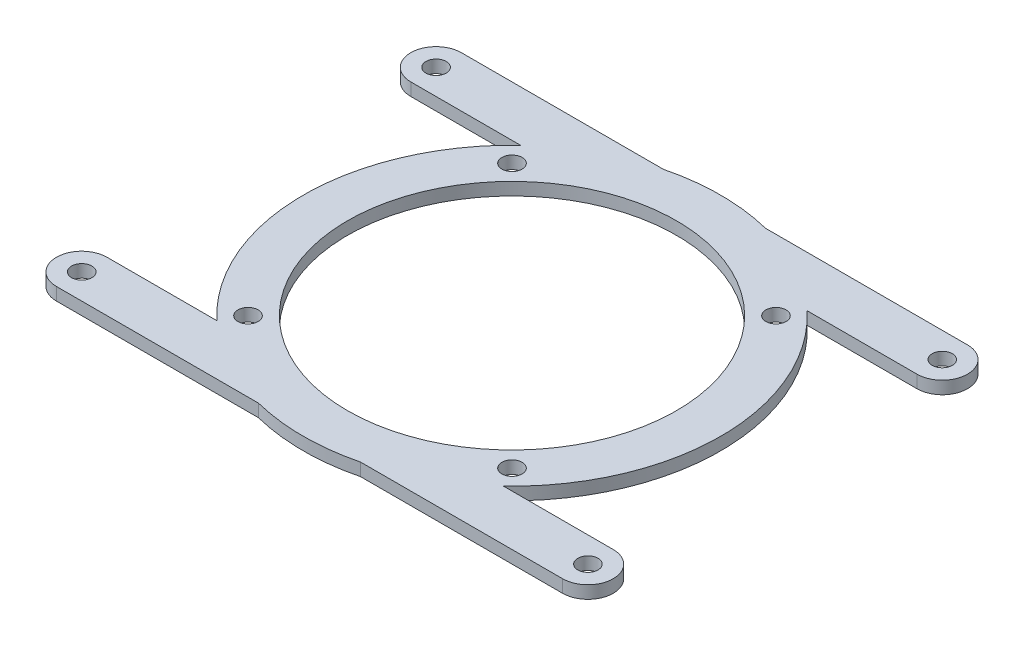
from build123d import *
from build123d.topology import SkipClean

# Parameters (mm, degrees)
SKETCH1_R           = 1.6
BOSS_EXTRUDE1_DEPTH = 2
SKETCH2_R           = 48
SKETCH2_R_2         = 42
SKETCH2_R_3         = 1.6
BOSS_EXTRUDE2_DEPTH = 2
SKETCH3_R           = 1.6
BOSS_EXTRUDE3_DEPTH = 2
CUT_EXTRUDE1_DEPTH  = 10
FILLET1_R           = 3
BOSS_EXTRUDE4_DEPTH = 2
CUT_EXTRUDE2_START  = -10
SKETCH6_R           = 26
CUT_EXTRUDE2_DEPTH  = 10
CUT_EXTRUDE3_START  = -10
SKETCH7_R           = 112.740823419
SKETCH7_R_2         = 33
CUT_EXTRUDE3_DEPTH  = 10
BOSS_EXTRUDE5_START = -2
SKETCH8_R           = 1.6
SKETCH8_R_2         = 26
BOSS_EXTRUDE5_DEPTH = 2
SKETCH9_R           = 1.6
CUT_EXTRUDE4_DEPTH  = 5


with BuildPart() as part:
    # Sketch1 → Boss-Extrude1 (new body)
    with BuildSketch(Plane(origin=(0, 0, 0), x_dir=(1, 0, 0), z_dir=(0, 1, 0))):
        with BuildLine():
            Line((-51.943772875, 37.828427125), (-29.299283734, 15.183937983))
            ThreePointArc((-29.299283734, 15.183937983), (0, 33), (29.299283734, 15.183937983))
            Line((29.299283734, 15.183937983), (51.943772875, 37.828427125))
            ThreePointArc((51.943772875, 37.828427125), (57.600627125, 37.828427125), (57.600627125, 32.171572875))
            Line((57.600627125, 32.171572875), (32.280845123, 6.851790873))
            ThreePointArc((32.280845123, 6.851790873), (33, 0), (32.280845123, -6.851790873))
            Line((32.280845123, -6.851790873), (57.600627125, -32.171572875))
            ThreePointArc((57.600627125, -32.171572875), (57.600627125, -37.828427125), (51.943772875, -37.828427125))
            Line((51.943772875, -37.828427125), (29.299283734, -15.183937983))
            ThreePointArc((29.299283734, -15.183937983), (0, -33), (-29.299283734, -15.183937983))
            Line((-29.299283734, -15.183937983), (-51.943772875, -37.828427125))
            ThreePointArc((-51.943772875, -37.828427125), (-57.600627125, -37.828427125), (-57.600627125, -32.171572875))
            Line((-57.600627125, -32.171572875), (-32.280845123, -6.851790873))
            ThreePointArc((-32.280845123, -6.851790873), (-33, 0), (-32.280845123, 6.851790873))
            Line((-32.280845123, 6.851790873), (-57.600627125, 32.171572875))
            ThreePointArc((-57.600627125, 32.171572875), (-57.600627125, 37.828427125), (-51.943772875, 37.828427125))
        make_face()
        with Locations(Location((54.7722, 35, 0), (0, 0, 270))):
            Circle(SKETCH1_R, mode=Mode.SUBTRACT)
        with Locations(Location((-54.7722, 35, 0), (0, 0, 90))):
            Circle(SKETCH1_R, mode=Mode.SUBTRACT)
        with Locations(Location((54.7722, -35, 0), (0, 0, 90))):
            Circle(SKETCH1_R, mode=Mode.SUBTRACT)
        with Locations(Location((-54.7722, -35, 0), (0, 0, 270))):
            Circle(SKETCH1_R, mode=Mode.SUBTRACT)
        with Locations(Location((20.859650045, 20.859650045, 0), (0, 0, 270))):
            Circle(SKETCH1_R, mode=Mode.SUBTRACT)
        with Locations(Location((-20.859650045, 20.859650045, 0), (0, 0, 90))):
            Circle(SKETCH1_R, mode=Mode.SUBTRACT)
        with Locations(Location((20.859650045, -20.859650045, 0), (0, 0, 90))):
            Circle(SKETCH1_R, mode=Mode.SUBTRACT)
        with Locations(Location((-20.859650045, -20.859650045, 0), (0, 0, 270))):
            Circle(SKETCH1_R, mode=Mode.SUBTRACT)
        with BuildLine():
            Line((0, 4.242640687), (-16.140662024, 20.383302711))
            ThreePointArc((-16.140662024, 20.383302711), (0, 26), (16.140662024, 20.383302711))
            Line((16.140662024, 20.383302711), (0, 4.242640687))
        make_face(mode=Mode.SUBTRACT)
        with BuildLine():
            Line((0, -4.242640687), (-16.140662024, -20.383302711))
            ThreePointArc((-16.140662024, -20.383302711), (0, -26), (16.140662024, -20.383302711))
            Line((16.140662024, -20.383302711), (0, -4.242640687))
        make_face(mode=Mode.SUBTRACT)
        with BuildLine():
            Line((4.242640687, 0), (20.383302711, -16.140662024))
            ThreePointArc((20.383302711, -16.140662024), (26, 0), (20.383302711, 16.140662024))
            Line((20.383302711, 16.140662024), (4.242640687, 0))
        make_face(mode=Mode.SUBTRACT)
        with BuildLine():
            Line((-4.242640687, 0), (-20.383302711, -16.140662024))
            ThreePointArc((-20.383302711, -16.140662024), (-26, 0), (-20.383302711, 16.140662024))
            Line((-20.383302711, 16.140662024), (-4.242640687, 0))
        make_face(mode=Mode.SUBTRACT)
    extrude(amount=BOSS_EXTRUDE1_DEPTH)

    # Sketch2 → Boss-Extrude2 (add)
    with BuildSketch(Plane(origin=(0, 2, 0), x_dir=(1, 0, 0), z_dir=(0, 1, 0))):
        Circle(SKETCH2_R)
        Circle(SKETCH2_R_2, mode=Mode.SUBTRACT)
        with Locations(Location((31.819805153, 31.819805153, 0), (0, 0, 270))):
            Circle(SKETCH2_R_3, mode=Mode.SUBTRACT)
        with Locations(Location((-31.819805153, 31.819805153, 0), (0, 0, 270))):
            Circle(SKETCH2_R_3, mode=Mode.SUBTRACT)
        with Locations(Location((31.819805153, -31.819805153, 0), (0, 0, 270))):
            Circle(SKETCH2_R_3, mode=Mode.SUBTRACT)
        with Locations(Location((-31.819805153, -31.819805153, 0), (0, 0, 270))):
            Circle(SKETCH2_R_3, mode=Mode.SUBTRACT)
    extrude(amount=-BOSS_EXTRUDE2_DEPTH)

    # Sketch3 → Boss-Extrude3 (add)
    # profile 1 of 2: a face of its own
    with BuildSketch(Plane(origin=(0, 2, 0), x_dir=(1, 0, 0), z_dir=(0, 1, 0))):
        with BuildLine():
            Line((34.819811892, 31.819805153), (34.819811892, -31.819805153))
            ThreePointArc((34.819811892, -31.819805153), (31.819805153, -34.819811892), (28.819798415, -31.819805153))
            Line((28.819798415, -31.819805153), (28.819798415, 31.819805153))
            ThreePointArc((28.819798415, 31.819805153), (31.819805153, 34.819811892), (34.819811892, 31.819805153))
        make_face()
        with Locations(Location((31.819805153, -31.819805153, 0), (0, 0, 270))):
            Circle(SKETCH3_R, mode=Mode.SUBTRACT)
        with Locations(Location((31.819805153, 31.819805153, 0), (0, 0, 270))):
            Circle(SKETCH3_R, mode=Mode.SUBTRACT)
    # profile 2 of 2: a face of its own
    with BuildSketch(Plane(origin=(0, 2, 0), x_dir=(1, 0, 0), z_dir=(0, 1, 0))):
        with BuildLine():
            Line((-28.819798415, -31.819805153), (-28.819798415, 31.819805153))
            ThreePointArc((-28.819798415, 31.819805153), (-31.819805153, 34.819811892), (-34.819811892, 31.819805153))
            Line((-34.819811892, 31.819805153), (-34.819811892, -31.819805153))
            ThreePointArc((-34.819811892, -31.819805153), (-31.819805153, -34.819811892), (-28.819798415, -31.819805153))
        make_face()
        with Locations(Location((-31.819805153, 31.819805153, 0), (0, 0, 270))):
            Circle(SKETCH3_R, mode=Mode.SUBTRACT)
        with Locations(Location((-31.819805153, -31.819805153, 0), (0, 0, 270))):
            Circle(SKETCH3_R, mode=Mode.SUBTRACT)
    extrude(amount=-BOSS_EXTRUDE3_DEPTH)

    # Sketch4 → Cut-Extrude1 (cut)
    with BuildSketch(Plane(origin=(0, 2, 0), x_dir=(1, 0, 0), z_dir=(0, 1, 0))):
        Polygon((-28.819805153, 31.819805153), (-28.819805153, 24.740165209), (0, 38.846192425), (28.819805153, 24.740165209), (28.819805153, 31.819805153), (28.819805153, 53.488724091), (-28.819805153, 53.488724091), align=None)
        Polygon((28.819805153, -31.819805153), (28.819805153, -27.443703625), (0, -37.592318486), (-28.819805153, -27.443703625), (-28.819805153, -31.819805153), (-28.819805153, -57.678243433), (28.819805153, -57.678243433), align=None)
    extrude(amount=-CUT_EXTRUDE1_DEPTH, mode=Mode.SUBTRACT)

    # Fillet1
    # the kernel refuses this fillet: 3 mm, written as the material it takes off along each edge
    with BuildSketch(Plane(origin=(-28.819805153, -16.95161691, -38.385138152), x_dir=(0, 0, 1), z_dir=(0, 1, 0)), Plane(origin=(28.819805153, -16.95161691, 38.385138152), x_dir=(0, 0, -1), z_dir=(0, 1, 0))) as fillet1_piece_1:
        with BuildLine():
            CenterArc((6.565332998, -3), FILLET1_R, 90, 135)
            ThreePointArc((4.444012655, -5.121320344), (2.131461319, -2.639230371), (0, 0))
            Line((0, 0), (6.565332998, 0))
        make_face()
    extrude(amount=35.903233819, mode=Mode.SUBTRACT)
    with BuildSketch(Plane(origin=(-28.819805153, -16.95161691, 38.385138152), x_dir=(-0.755284934005079, 0, -0.6553965734308833), z_dir=(0, 1, 0)), Plane(origin=(28.819805153, -16.95161691, -38.385138152), x_dir=(0.7552849340050823, 0, 0.6553965734308795), z_dir=(0, 1, 0))) as fillet1_piece_2:
        with BuildLine():
            CenterArc((6.568751552, -2.99250738), FILLET1_R, 85.949727095, 135)
            Line((4.30289675, -4.9586971), (0, 0))
            ThreePointArc((0, 0), (3.390323382, 0.11988192), (6.780646764, 0))
        make_face()
    extrude(amount=35.903233819, mode=Mode.SUBTRACT)


with BuildPart() as boss_extrude4_tool:
    # Sketch5 → Boss-Extrude4 (new body)
    with BuildSketch(Plane(origin=(0, 2, 0), x_dir=(1, 0, 0), z_dir=(0, 1, 0))):
        Polygon((-31.819798415, 34.819811892), (31.819798415, 34.819811892), (29.753362448, 32.753375926), (28.819798415, 31.819811892), (28.819798415, 28.819811892), (0, 28.819811892), (-28.819798415, 28.819811892), (-28.819798415, 31.819811892), align=None)
        Polygon((-28.819798415, -31.819811892), (-31.819798415, -34.819811892), (31.819798415, -34.819811892), (29.753362448, -32.753375926), (28.819798415, -31.819811892), (28.819798415, -28.819811892), (0, -28.819811892), (-28.819798415, -28.819811892), align=None)
    extrude(amount=-BOSS_EXTRUDE4_DEPTH)


with BuildPart() as part_1:
    add(part.part)


with BuildPart() as part_2:
    # Boss-Extrude4: joined with boss_extrude4_tool
    add(part_1.part.fuse(boss_extrude4_tool.part, tol=0.00001))

    # Sketch6 → Cut-Extrude2 (cut)
    with BuildSketch(Plane(origin=(0, 2, 0), x_dir=(1, 0, 0), z_dir=(0, 1, 0)).offset(CUT_EXTRUDE2_START)):
        with Locations(Location((0, 0, 0), (0, 0, 270))):
            Circle(SKETCH6_R)
    extrude(amount=CUT_EXTRUDE2_DEPTH, mode=Mode.SUBTRACT)

    # Sketch7 → Cut-Extrude3 (cut)
    with SkipClean():  # the faces are left unmerged after this step: merging them gives an invalid solid
        with BuildSketch(Plane(origin=(0, 2, 0), x_dir=(1, 0, 0), z_dir=(0, 1, 0)).offset(CUT_EXTRUDE3_START)):
            Circle(SKETCH7_R)
            with Locations(Location((0, 0, 0), (0, 0, 270))):
                Circle(SKETCH7_R_2, mode=Mode.SUBTRACT)
        extrude(amount=CUT_EXTRUDE3_DEPTH, mode=Mode.SUBTRACT)

    # Sketch8 → Boss-Extrude5 (add)
    # profile 1 of 5: a face of its own
    with SkipClean():  # the faces are left unmerged after this step: merging them gives an invalid solid
        with BuildSketch(Plane(origin=(0, 2, 0), x_dir=(1, 0, 0), z_dir=(0, 1, 0)).offset(BOSS_EXTRUDE5_START)):
            with BuildLine():
                ThreePointArc((60, 24), (64, 28), (60, 32))
                Line((60, 32), (8.062257748, 32))
                ThreePointArc((8.062257748, 32), (15.86830384, 28.934355587), (22.649503306, 24))
                Line((22.649503306, 24), (60, 24))
            make_face()
            with Locations(Location((60, 28, 0), (0, 0, 270))):
                Circle(SKETCH8_R, mode=Mode.SUBTRACT)
        # profile 2 of 5: a face of its own
        with BuildSketch(Plane(origin=(0, 2, 0), x_dir=(1, 0, 0), z_dir=(0, 1, 0)).offset(BOSS_EXTRUDE5_START)):
            with BuildLine():
                ThreePointArc((-22.649503306, 24), (-15.86830384, 28.934355587), (-8.062257748, 32))
                Line((-8.062257748, 32), (-60, 32))
                ThreePointArc((-60, 32), (-64, 28), (-60, 24))
                Line((-60, 24), (-22.649503306, 24))
            make_face()
            with Locations(Location((-60, 28, 0), (0, 0, 270))):
                Circle(SKETCH8_R, mode=Mode.SUBTRACT)
        # profile 3 of 5: a face of its own
        with BuildSketch(Plane(origin=(0, 2, 0), x_dir=(1, 0, 0), z_dir=(0, 1, 0)).offset(BOSS_EXTRUDE5_START)):
            with BuildLine():
                ThreePointArc((-8.062257748, -32), (-15.86830384, -28.934355587), (-22.649503306, -24))
                Line((-22.649503306, -24), (-60, -24))
                ThreePointArc((-60, -24), (-64, -28), (-60, -32))
                Line((-60, -32), (-8.062257748, -32))
            make_face()
            with Locations(Location((-60, -28, 0), (0, 0, 270))):
                Circle(SKETCH8_R, mode=Mode.SUBTRACT)
        # profile 4 of 5: a face of its own
        with BuildSketch(Plane(origin=(0, 2, 0), x_dir=(1, 0, 0), z_dir=(0, 1, 0)).offset(BOSS_EXTRUDE5_START)):
            with BuildLine():
                Line((60, -24), (22.649503306, -24))
                ThreePointArc((22.649503306, -24), (15.86830384, -28.934355587), (8.062257748, -32))
                Line((8.062257748, -32), (60, -32))
                ThreePointArc((60, -32), (64, -28), (60, -24))
            make_face()
            with Locations(Location((60, -28, 0), (0, 0, 270))):
                Circle(SKETCH8_R, mode=Mode.SUBTRACT)
        # profile 5 of 5: a face of its own
        with BuildSketch(Plane(origin=(0, 2, 0), x_dir=(1, 0, 0), z_dir=(0, 1, 0)).offset(BOSS_EXTRUDE5_START)):
            with BuildLine():
                Line((22.649503306, 24), (0, 32))
                Line((0, 32), (-22.649503306, 24))
                ThreePointArc((-22.649503306, 24), (-33, 0), (-22.649503306, -24))
                Line((-22.649503306, -24), (0, -32))
                Line((0, -32), (22.649503306, -24))
                ThreePointArc((22.649503306, -24), (30.302092412, -13.068404472), (33, 0))
                ThreePointArc((33, 0), (30.302092412, 13.068404472), (22.649503306, 24))
            make_face()
            with Locations(Location((-20.859650045, -20.859650045, 0), (0, 0, 270))):
                Circle(SKETCH8_R, mode=Mode.SUBTRACT)
            with Locations(Location((20.859650045, -20.859650045, 0), (0, 0, 90))):
                Circle(SKETCH8_R, mode=Mode.SUBTRACT)
            with Locations(Location((-20.859650045, 20.859650045, 0), (0, 0, 90))):
                Circle(SKETCH8_R, mode=Mode.SUBTRACT)
            with Locations(Location((0, 0, 0), (0, 0, 270))):
                Circle(SKETCH8_R_2, mode=Mode.SUBTRACT)
            with Locations(Location((20.859650045, 20.859650045, 0), (0, 0, 270))):
                Circle(SKETCH8_R, mode=Mode.SUBTRACT)
        extrude(amount=BOSS_EXTRUDE5_DEPTH)

    # Sketch9 → Cut-Extrude4 (cut)
    with SkipClean():  # the faces are left unmerged after this step: merging them gives an invalid solid
        with BuildSketch(Plane(origin=(0, 2, 0), x_dir=(1, 0, 0), z_dir=(0, 1, 0))):
            with Locations(Location((40, 28, 0), (0, 0, 270))):
                Circle(SKETCH9_R)
            with Locations(Location((-40, 28, 0), (0, 0, 270))):
                Circle(SKETCH9_R)
            with Locations(Location((-40, -28, 0), (0, 0, 270))):
                Circle(SKETCH9_R)
            with Locations(Location((40, -28, 0), (0, 0, 270))):
                Circle(SKETCH9_R)
            with BuildLine():
                Line((-40, 32), (-88.801231513, 51.827440304))
                Line((-88.801231513, 51.827440304), (-77.903174013, 7.237500813))
                Line((-77.903174013, 7.237500813), (-40, 24))
                ThreePointArc((-40, 24), (-44, 28), (-40, 32))
            make_face()
            with BuildLine():
                Line((-40, -24), (-110.099658322, -14.969056523))
                Line((-110.099658322, -14.969056523), (-87.813441409, -65.362398728))
                Line((-87.813441409, -65.362398728), (-40, -32))
                ThreePointArc((-40, -32), (-44, -28), (-40, -24))
            make_face()
            with BuildLine():
                Line((40, -32), (82.780855651, -58.25577253))
                Line((82.780855651, -58.25577253), (126.86328335, 11.448571628))
                Line((126.86328335, 11.448571628), (40, -24))
                ThreePointArc((40, -24), (44, -28), (40, -32))
            make_face()
            with BuildLine():
                Line((40, 24), (64.956913766, 7.237500813))
                Line((64.956913766, 7.237500813), (132.433265189, 44.868462663))
                Line((132.433265189, 44.868462663), (31.218738054, 101.841419761))
                Line((31.218738054, 101.841419761), (40, 32))
                ThreePointArc((40, 32), (44, 28), (40, 24))
            make_face()
        extrude(amount=-CUT_EXTRUDE4_DEPTH, mode=Mode.SUBTRACT)


solid = part_2.part
